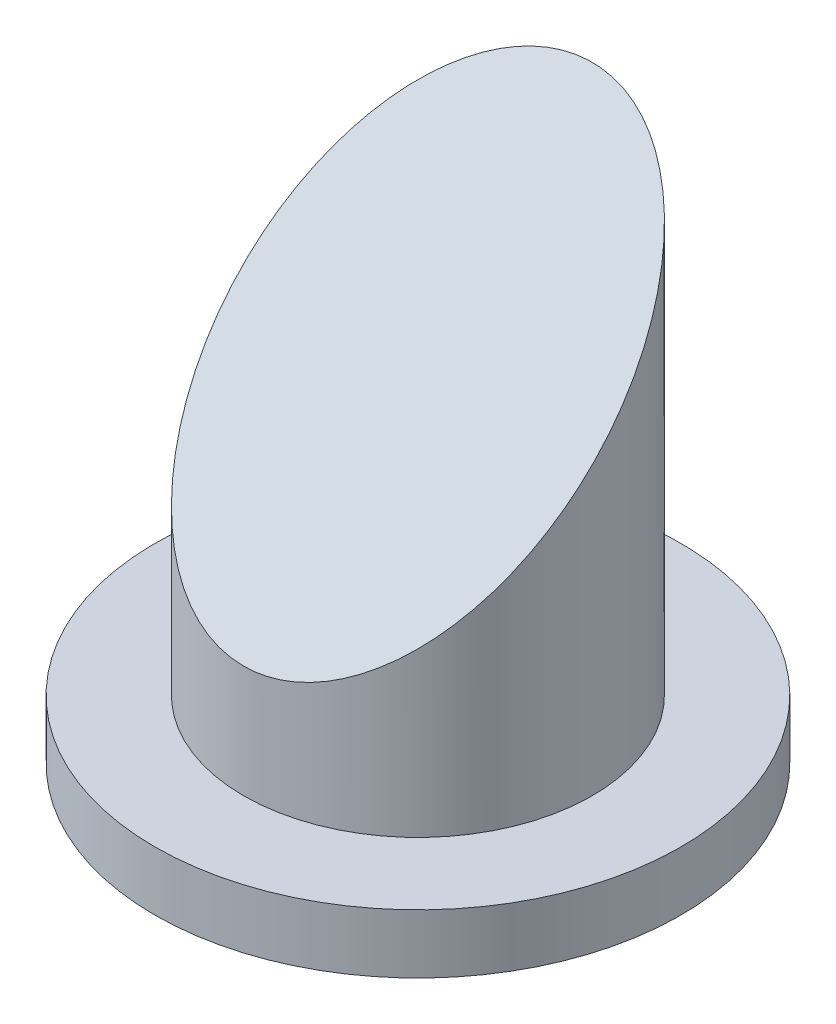
from build123d import *

# Parameters (mm, degrees)
SKETCH1_R               = 8.9
BOSS_EXTRUDE1_DEPTH     = 2
SKETCH2_R               = 5.9
BOSS_EXTRUDE2_DEPTH     = 20
CUT_EXTRUDE1_DEPTH      = 26.346005602
CUT_EXTRUDE1_DEPTH_BACK = 26.346005602
SKETCH4_W               = 1
SKETCH4_H               = 2
CUT_EXTRUDE2_DEPTH      = 1.2
FILLET1_R               = 0.25


with BuildPart() as part:
    # Sketch1 → Boss-Extrude1 (new body)
    with BuildSketch(Plane(origin=(0, 0, 0), x_dir=(1, 0, 0), z_dir=(0, 1, 0))):
        Circle(SKETCH1_R)
    extrude(amount=BOSS_EXTRUDE1_DEPTH)

    # Sketch2 → Boss-Extrude2 (add)
    with BuildSketch(Plane(origin=(0, 2, 0), x_dir=(1, 0, 0), z_dir=(0, 1, 0))):
        Circle(SKETCH2_R)
    extrude(amount=BOSS_EXTRUDE2_DEPTH)

    # Sketch3 → Cut-Extrude1 (cut, two sides: drawn at the far end of the back side and taken through both)
    with BuildSketch(Plane(origin=(0, 0, 0), x_dir=(0, 0, -1), z_dir=(1, 0, 0)).offset(-CUT_EXTRUDE1_DEPTH_BACK)):
        Polygon((-6.28, 28.771900514), (-6.28, 5.42), (6.28, 17.98), (6.28, 28.771900514), align=None)
    extrude(amount=CUT_EXTRUDE1_DEPTH + CUT_EXTRUDE1_DEPTH_BACK, mode=Mode.SUBTRACT)

    # Sketch4 → Cut-Extrude2 (cut)
    with BuildSketch(Plane.XZ):
        with Locations((0, -4)):
            Rectangle(SKETCH4_W, SKETCH4_H)
    extrude(amount=-CUT_EXTRUDE2_DEPTH, mode=Mode.SUBTRACT)

    # Fillet1
    fillet1_edges = [part.edges().sort_by_distance(p)[0] for p in [
        (0, 1.2, -3),
        (0.5, 1.2, -4),
        (0, 1.2, -5),
        (-0.5, 1.2, -4),
        (-0.5, 0.6, -5),
        (-0.5, 0.6, -3),
        (0.5, 0.6, -5),
        (0.5, 0.6, -3),
    ]]
    fillet(fillet1_edges, radius=FILLET1_R)


solid = part.part
